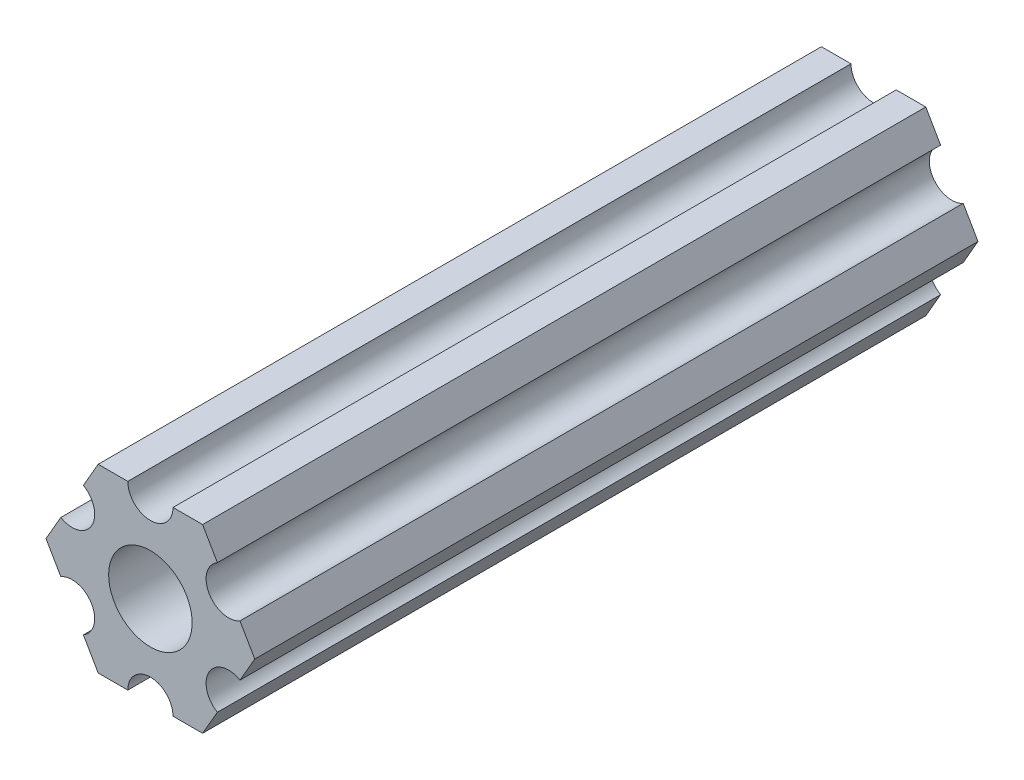
from build123d import *

# Parameters (mm, degrees)
SKETCH1_R           = 2.9337
BOSS_EXTRUDE1_DEPTH = 50.8


with BuildPart() as part:
    # Sketch1 → Boss-Extrude1 (new body)
    with BuildSketch(Plane.XY):
        with BuildLine():
            Line((-4.70551159, -4.549815043), (-3.666174521, -6.349999904))
            Line((-3.666174521, -6.349999904), (-1.587501154, -6.349999904))
            ThreePointArc((-1.587501154, -6.349999904), (-3.85e-07, -4.762499134), (1.587501154, -6.349999904))
            Line((1.587501154, -6.349999904), (3.666173825, -6.349999904))
            Line((3.666173825, -6.349999904), (4.705510929, -4.549815232))
            ThreePointArc((4.705510929, -4.549815232), (4.124445601, -2.381249904), (6.293010929, -1.800184575))
            Line((6.293010929, -1.800184575), (7.332348034, 9.6e-08))
            Line((7.332348034, 9.6e-08), (6.293011178, 1.800184715))
            ThreePointArc((6.293011178, 1.800184715), (4.124445902, 2.381250241), (4.705511428, 4.549815516))
            Line((4.705511428, 4.549815516), (3.666174521, 6.350000222))
            Line((3.666174521, 6.350000222), (1.587498846, 6.350000222))
            ThreePointArc((1.587498846, 6.350000222), (3.85e-07, 4.762501761), (-1.587498846, 6.350000222))
            Line((-1.587498846, 6.350000222), (-3.666173825, 6.350000222))
            Line((-3.666173825, 6.350000222), (-4.705511038, 4.549815614))
            ThreePointArc((-4.705511038, 4.549815614), (-4.124445841, 2.38125025), (-6.293011205, 1.800185053))
            Line((-6.293011205, 1.800185053), (-7.332348419, 4.44e-07))
            Line((-7.332348419, 4.44e-07), (-6.293011423, -1.80018429))
            ThreePointArc((-6.293011423, -1.80018429), (-4.12444613, -2.38124975), (-4.70551159, -4.549815043))
        make_face()
        Circle(SKETCH1_R, mode=Mode.SUBTRACT)
    extrude(amount=-BOSS_EXTRUDE1_DEPTH)


solid = part.part
